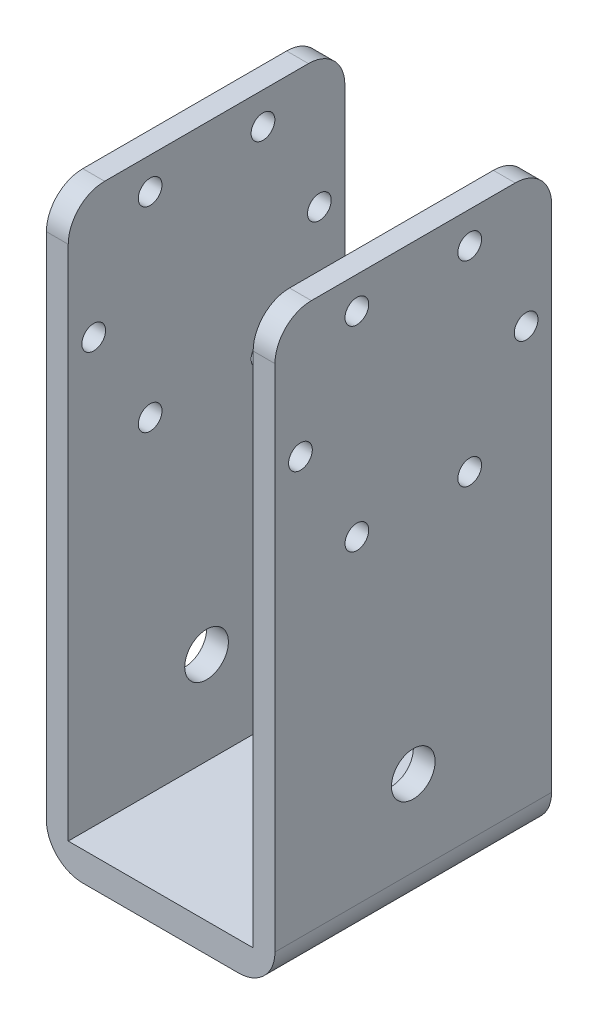
from build123d import *

# Parameters (mm, degrees)
BOSS_EXTRUDE1_DEPTH = 19
SKETCH2_R           = 1.63
CUT_EXTRUDE1_DEPTH  = 89.016816575
FILLET1_R           = 5
SKETCH4_R           = 3
CUT_EXTRUDE3_DEPTH  = 89.016816575


with BuildPart() as part:
    # Sketch1 → Boss-Extrude1 (new, symmetric)
    with BuildSketch(Plane.XY):
        Polygon((-15.7, 80), (-12.7, 80), (-12.7, 4), (12.7, 4), (12.7, 80), (15.7, 80), (15.7, 0), (-15.7, 0), align=None)
    extrude(amount=BOSS_EXTRUDE1_DEPTH, both=True)

    # Sketch2 → Cut-Extrude1 (cut, through all)
    with BuildSketch(Plane(origin=(15.7, 0, 0), x_dir=(0, 0, -1), z_dir=(1, 0, 0))):
        with Locations((-7.75, 75.63)):
            Circle(SKETCH2_R)
        with Locations((7.75, 75.63)):
            Circle(SKETCH2_R)
        with Locations((-15.5, 62.2)):
            Circle(SKETCH2_R)
        with Locations((15.5, 62.2)):
            Circle(SKETCH2_R)
        with Locations((-7.75, 48.77)):
            Circle(SKETCH2_R)
        with Locations((7.75, 48.77)):
            Circle(SKETCH2_R)
    extrude(amount=-CUT_EXTRUDE1_DEPTH, mode=Mode.SUBTRACT)

    # Fillet1
    fillet1_edges = [part.edges().sort_by_distance(p)[0] for p in [
        (-15.7, 0, 0),
        (15.7, 0, 0),
        (-14.2, 80, 19),
        (-14.2, 80, -19),
        (14.2, 80, -19),
        (14.2, 80, 19),
    ]]
    fillet(fillet1_edges, radius=FILLET1_R)

    # Sketch4 → Cut-Extrude3 (cut, through all)
    with BuildSketch(Plane(origin=(15.7, 0, 0), x_dir=(0, 0, -1), z_dir=(1, 0, 0))):
        with Locations((0, 16.7)):
            Circle(SKETCH4_R)
    extrude(amount=-CUT_EXTRUDE3_DEPTH, mode=Mode.SUBTRACT)


solid = part.part
